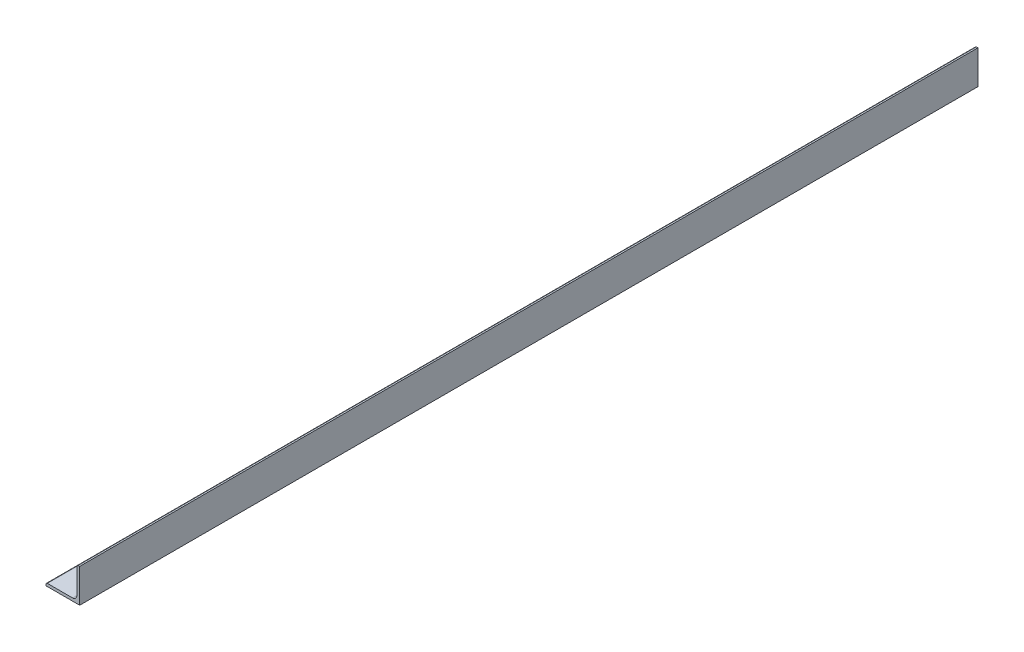
from build123d import *

# Parameters (mm, degrees)
BOSS_EXTRUDE1_DEPTH        = 254
F_10_CLEARANCE_HOLE1_D     = 4.9784
F_10_CLEARANCE_HOLE1_DEPTH = 3.302
F_10_CLEARANCE_HOLE1_TIP   = 1.495662253


with BuildPart() as part:
    # Sketch2 → Boss-Extrude1 (new, symmetric)
    with BuildSketch(Plane.XY):
        with BuildLine():
            Line((-9.525, -9.525), (9.525, -9.525))
            Line((9.525, -9.525), (9.525, 9.525))
            Line((9.525, 9.525), (8.73125, 9.525))
            ThreePointArc((8.73125, 9.525), (8.169983992, 9.292516008), (7.9375, 8.73125))
            Line((7.9375, 8.73125), (7.9375, -5.5499))
            ThreePointArc((7.9375, -5.5499), (7.238188151, -7.238188151), (5.5499, -7.9375))
            Line((5.5499, -7.9375), (-8.73125, -7.9375))
            ThreePointArc((-8.73125, -7.9375), (-9.292516008, -8.169983992), (-9.525, -8.73125))
            Line((-9.525, -8.73125), (-9.525, -9.525))
        make_face()
    extrude(amount=BOSS_EXTRUDE1_DEPTH, both=True)

    # #10 Clearance Hole1
    with Locations(Plane(origin=(0, -9.525, 0), x_dir=(-1, 0, 0), z_dir=(0, -1, 0))):
        with Locations((-3.136770585, 241.501683504), (-3.136770585, 216.101683504), (-2.973316496, -241.261770585), (-2.973316496, -215.9)):
            Hole(F_10_CLEARANCE_HOLE1_D / 2, depth=F_10_CLEARANCE_HOLE1_DEPTH)
            with Locations((0, 0, -(F_10_CLEARANCE_HOLE1_DEPTH + F_10_CLEARANCE_HOLE1_TIP / 2))):  # 118° drill point
                Cone(0, F_10_CLEARANCE_HOLE1_D / 2, F_10_CLEARANCE_HOLE1_TIP, mode=Mode.SUBTRACT)


solid = part.part
